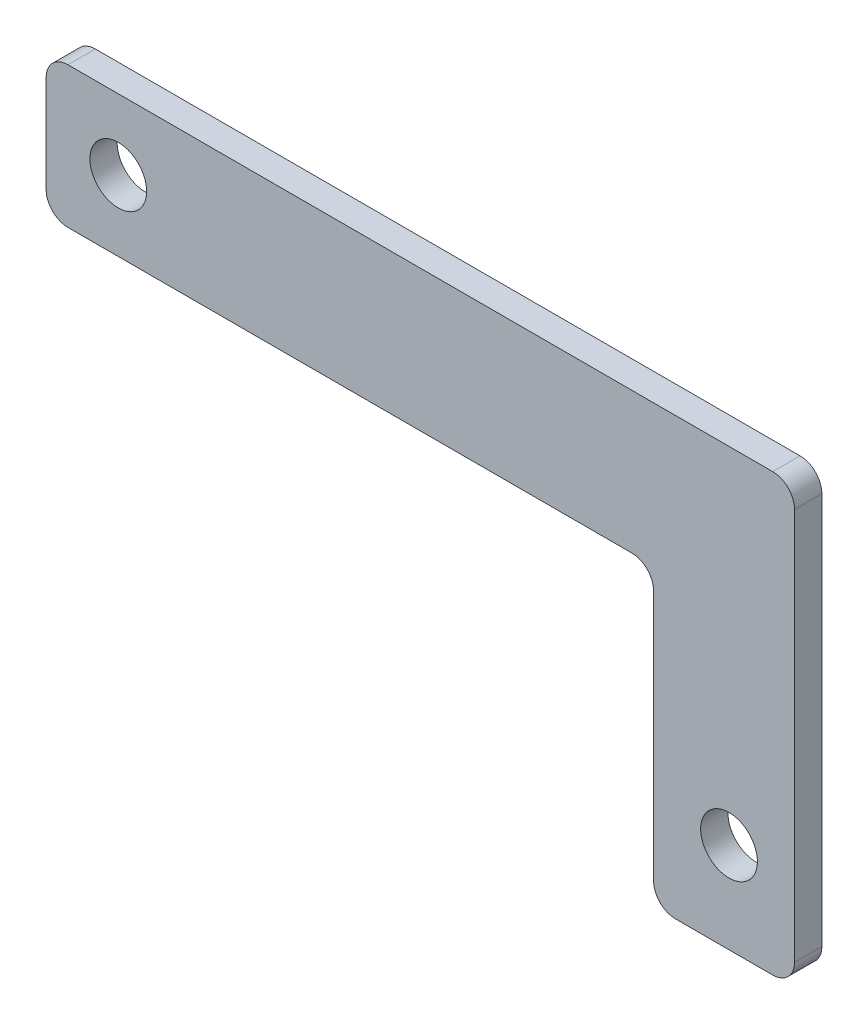
from build123d import *

# Parameters (mm, degrees)
BASE_FLANGE1_DEPTH   = 3.175
M6_CLEARANCE_HOLE1_D = 6.6
FILLET1_R            = 2.54


# Sheet-metal steps are written as plain solids
with BuildPart() as part:
    # Sketch1 → Base-Flange1 (new body)
    with BuildSketch(Plane.XY):
        Polygon((47.801569048, -78.501600001), (-22.7939, -78.501600001), (-22.7939, -62.123600001), (64.179569048, -62.123600001), (64.179569048, -112.791600001), (47.801569048, -112.791600001), align=None)
    extrude(amount=-BASE_FLANGE1_DEPTH)

    # M6 Clearance Hole1 (through all)
    with Locations(Plane.XY):
        with Locations((56.565919048, -102.268610498), (-14.4119, -70.312600001)):
            Hole(M6_CLEARANCE_HOLE1_D / 2)

    # Fillet1
    fillet1_edges = [part.edges().sort_by_distance(p)[0] for p in [
        (-22.7939, -62.123600001, -1.5875),
        (64.179569048, -62.123600001, -1.5875),
        (64.179569048, -112.791600001, -1.5875),
        (47.801569048, -112.791600001, -1.5875),
        (47.801569048, -78.501600001, -1.5875),
        (-22.7939, -78.501600001, -1.5875),
    ]]
    fillet(fillet1_edges, radius=FILLET1_R)


solid = part.part
